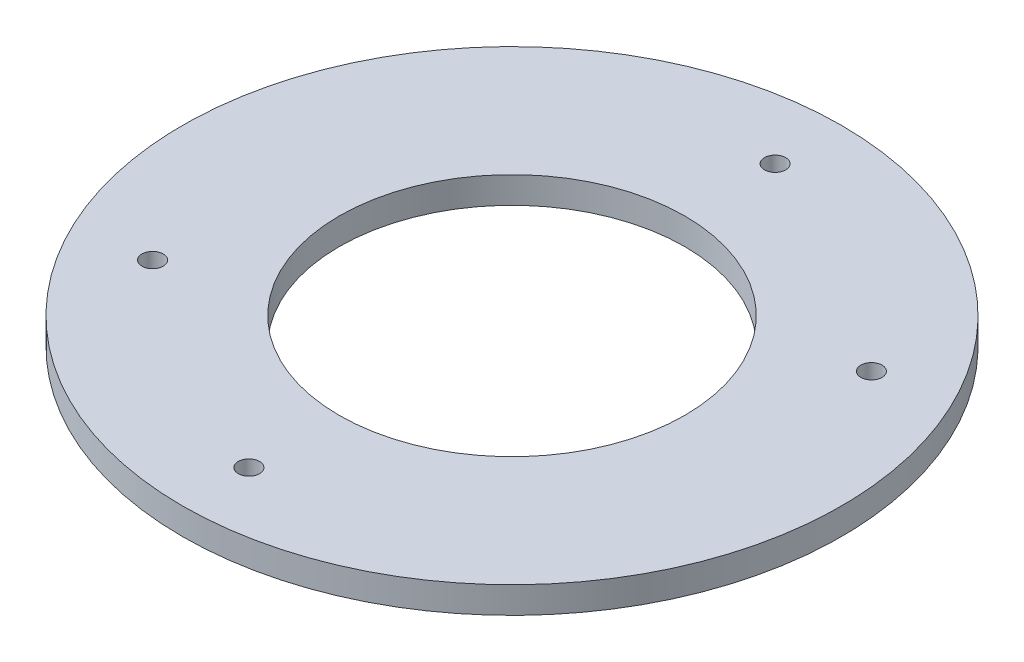
from build123d import *

# Parameters (mm, degrees)
SKETCH1_R               = 62
BOSS_EXTRUDE1_DEPTH     = 5
SKETCH2_R               = 2
CUT_EXTRUDE1_DEPTH      = 5
CIRPATTERN1_COUNT       = 2
CIRPATTERN1_ANGLE       = 120
MIRROR1_COPY_1_SKETCH_R = 2
MIRROR1_COPY_1_DEPTH    = 5
SKETCH5_R               = 32.5
CUT_EXTRUDE2_DEPTH      = 10


with BuildPart() as part:
    # Sketch1 → Boss-Extrude1 (new body)
    with BuildSketch(Plane(origin=(0, 0, 0), x_dir=(1, 0, 0), z_dir=(0, 1, 0))):
        Circle(SKETCH1_R)
    extrude(amount=BOSS_EXTRUDE1_DEPTH)

    # Sketch2 → Cut-Extrude1 (cut)
    with BuildSketch(Plane(origin=(0, 5, 0), x_dir=(1, 0, 0), z_dir=(0, 1, 0))):
        with Locations((0, 49.5)):
            Circle(SKETCH2_R)
    cut_extrude1 = extrude(amount=-CUT_EXTRUDE1_DEPTH, mode=Mode.SUBTRACT)

    # CirPattern1: Cut-Extrude1 ×2 about axis
    cirpattern1_axis = Axis((0, 5, 0), (0, 1, 0))
    for i in range(1, CIRPATTERN1_COUNT):
        add(cut_extrude1.rotate(cirpattern1_axis, i * CIRPATTERN1_ANGLE / (CIRPATTERN1_COUNT - 1)), mode=Mode.SUBTRACT)

    # Mirror1: Cut-Extrude1 across plane
    add(cut_extrude1.mirror(Plane(origin=(0, 0, 0), x_dir=(-0.49999999999999806, 0, 0.8660254037844398), z_dir=(-0.8660254037844398, 0, -0.49999999999999806))), mode=Mode.SUBTRACT)

    # Mirror1 copy 1 sketch → Mirror1 copy 1 (cut)
    with BuildSketch(Plane(origin=(0, 5, 0), x_dir=(1, 0, 0), z_dir=(0, 1, 0))):
        with Locations((0, -49.5)):
            Circle(MIRROR1_COPY_1_SKETCH_R)
    extrude(amount=-MIRROR1_COPY_1_DEPTH, mode=Mode.SUBTRACT)

    # Sketch5 → Cut-Extrude2 (cut)
    with BuildSketch(Plane.XZ):
        Circle(SKETCH5_R)
    extrude(amount=-CUT_EXTRUDE2_DEPTH, mode=Mode.SUBTRACT)


solid = part.part
